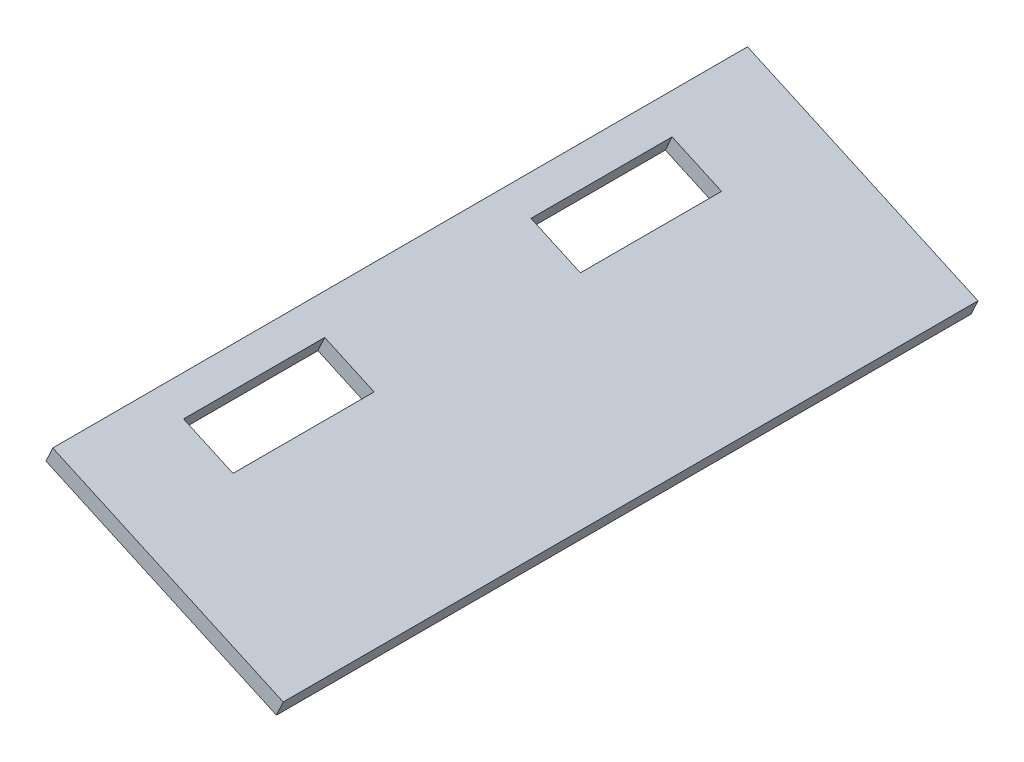
from build123d import *

# Parameters (mm, degrees)
BOSS_EXTRUDE1_DEPTH = 812.8
SKETCH8_W           = 63.5
SKETCH8_H           = 165.1
CUT_EXTRUDE1_DEPTH  = 19.05


with BuildPart() as part:
    # Sketch6 → Boss-Extrude1 (new body)
    with BuildSketch(Plane.XY):
        Polygon((-729.301552161, 1689.357876206), (-459.704795919, 1566.813896096), (-467.587742008, 1549.4714147), (-737.18449825, 1672.01539481), align=None)
    extrude(amount=BOSS_EXTRUDE1_DEPTH)

    # Sketch8 → Cut-Extrude1 (cut)
    with BuildSketch(Plane(origin=(503.63859081, 1108.004899783, 0), x_dir=(0.9103664774626058, -0.41380294430118175, 0), z_dir=(-0.41380294430118175, -0.9103664774626058, 0))):
        with Locations((-1295.655978481, 203.2)):
            Rectangle(SKETCH8_W, SKETCH8_H)
        with Locations((-1295.655978481, 609.6)):
            Rectangle(SKETCH8_W, SKETCH8_H)
    extrude(amount=-CUT_EXTRUDE1_DEPTH, mode=Mode.SUBTRACT)


solid = part.part
